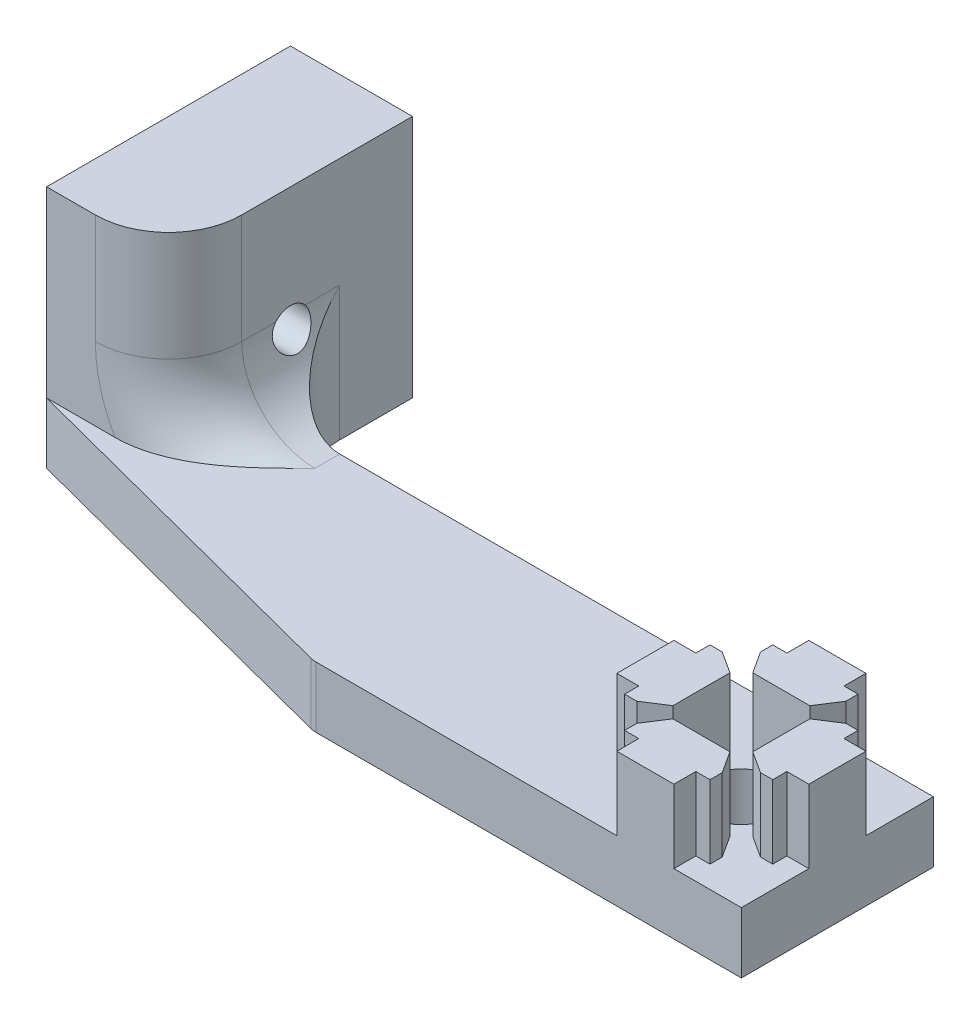
from build123d import *

# Parameters (mm, degrees)
BOSS_EXTRUDE1_DEPTH   = 7.62
BOSS_EXTRUDE1_2_DEPTH = 7.62
BOSS_EXTRUDE1_3_DEPTH = 7.62
BOSS_EXTRUDE1_4_DEPTH = 7.62
SKETCH2_W             = 82.1538108
SKETCH2_H             = 20
BOSS_EXTRUDE2_DEPTH   = 6.35
CUT_EXTRUDE1_DEPTH    = 75.17097352
FILLET1_R             = 2.54
SKETCH6_W             = 25.4
SKETCH6_H             = 25.4
BOSS_EXTRUDE7_DEPTH   = 12.7
FILLET3_R             = 7.62
FILLET5_R             = 7.62
SKETCH11_R            = 1.984375
CUT_EXTRUDE3_DEPTH    = 89.015038158
SKETCH12_R            = 3.556
CUT_EXTRUDE4_DEPTH    = 79.762749597


with BuildPart() as part:
    # Sketch1 → Boss-Extrude1 (new body)
    with BuildSketch(Plane(origin=(0, 0, 0), x_dir=(1, 0, 0), z_dir=(0, 1, 0))):
        Polygon((-2.9718, 10), (-2.9718, 7.714), (-4.4450054, 7.714), (-4.4450054, 6.444), (-2.9718, 4.158), (2.9718, 4.158), (4.4449946, 6.444), (4.4449946, 7.714), (2.9718, 7.714), (2.9718, 10), align=None)
    extrude(amount=BOSS_EXTRUDE1_DEPTH)



with BuildPart() as body_2:
    # Sketch1 → Boss-Extrude1 2 (new body)
    with BuildSketch(Plane(origin=(0, 0, 0), x_dir=(1, 0, 0), z_dir=(0, 1, 0))):
        Polygon((4.158, -2.9718), (4.158, 2.9718), (6.444, 4.4449946), (7.714, 4.4449946), (7.714, 2.9718), (10, 2.9718), (10, -2.9718), (7.714, -2.9718), (7.714, -4.4450054), (6.444, -4.4450054), align=None)
    extrude(amount=BOSS_EXTRUDE1_2_DEPTH)


with BuildPart() as body_3:
    # Sketch1 → Boss-Extrude1 3 (new body)
    with BuildSketch(Plane(origin=(0, 0, 0), x_dir=(1, 0, 0), z_dir=(0, 1, 0))):
        Polygon((4.4450054, -6.444), (2.9718, -4.158), (-2.9718, -4.158), (-4.4449946, -6.444), (-4.4449946, -7.714), (-2.9718, -7.714), (-2.9718, -10), (2.9718, -10), (2.9718, -7.714), (4.4450054, -7.714), align=None)
    extrude(amount=BOSS_EXTRUDE1_3_DEPTH)


with BuildPart() as body_4:
    # Sketch1 → Boss-Extrude1 4 (new body)
    with BuildSketch(Plane(origin=(0, 0, 0), x_dir=(1, 0, 0), z_dir=(0, 1, 0))):
        Polygon((-10, -2.9718), (-10, 2.9718), (-7.714, 2.9718), (-7.714, 4.4450054), (-6.444, 4.4450054), (-4.158, 2.9718), (-4.158, -2.9718), (-6.444, -4.4449946), (-7.714, -4.4449946), (-7.714, -2.9718), align=None)
    extrude(amount=BOSS_EXTRUDE1_4_DEPTH)


with BuildPart() as part_1:
    add(part.part)

    add(body_2.part)  # Boss-Extrude2 merges body 2

    add(body_3.part)  # Boss-Extrude2 merges body 3

    add(body_4.part)  # Boss-Extrude2 merges body 4
    # Sketch2 → Boss-Extrude2 (add)
    with BuildSketch(Plane.XZ):
        with Locations((-31.0769054, 0)):
            Rectangle(SKETCH2_W, SKETCH2_H)
    extrude(amount=BOSS_EXTRUDE2_DEPTH)

    # Sketch4 → Cut-Extrude1 (cut, through all)
    with BuildSketch(Plane(origin=(0, -6.35, 0), x_dir=(-1, 0, 0), z_dir=(0, -1, 0))):
        Polygon((72.1538108, -10), (34.6126108, -10), (72.1538108, -0.2108), align=None)
    extrude(amount=-CUT_EXTRUDE1_DEPTH, mode=Mode.SUBTRACT)

    # Fillet1
    fillet1_edges = [part_1.edges().sort_by_distance(p)[0] for p in [
        (-34.6126108, -3.175, 10),
    ]]
    fillet(fillet1_edges, radius=FILLET1_R)

    # Sketch6 → Boss-Extrude7 (add)
    with BuildSketch(Plane.ZY.offset(72.1538108)):
        with Locations((-12.4892, 6.35)):
            Rectangle(SKETCH6_W, SKETCH6_H)
    extrude(amount=-BOSS_EXTRUDE7_DEPTH)

    # Fillet3
    fillet3_edges = [part_1.edges().sort_by_distance(p)[0] for p in [
        (-59.4538108, 0, -4.8946),
        (-59.4538108, -3.175, -10),
    ]]
    fillet(fillet3_edges, radius=FILLET3_R)

    # Fillet5
    # the kernel refuses this fillet: 7.62 mm, written as the material it takes off along each edge
    with BuildSketch(Plane(origin=(-59.4538108, 38.1, 0.2108), x_dir=(-1, 0, 0), z_dir=(0, -1, 0))) as fillet5_piece_1:
        with BuildLine():
            CenterArc((FILLET5_R, FILLET5_R), FILLET5_R, 180, 90)
            Line((0, FILLET5_R), (0, 0))
            Line((0, 0), (FILLET5_R, 0))
        make_face()
    extrude(amount=30.48, mode=Mode.SUBTRACT)
    with BuildSketch(Plane(origin=(-51.8338108, 7.62, 0.2108), x_dir=(0.5976672776328273, 0.8017442392976484, 0), z_dir=(-0.8017442392976484, 0.5976672776328273, 0))) as fillet5_piece_2_section:
        with BuildLine():
            CenterArc((7.62 + FILLET5_R, FILLET5_R), FILLET5_R, 180, 90)
            Line((7.62, FILLET5_R), (7.62, 0))
            Line((7.62, 0), (7.62 + FILLET5_R, 0))
        make_face()
    fillet5_piece_2 = revolve(axis=Axis((-51.8338108, 7.62, 0.2108), (0, 0, -1)), revolution_arc=233.296989237, mode=Mode.PRIVATE)
    fillet5_piece_2 = split(fillet5_piece_2, bisect_by=Plane(origin=(-57.548345525, 0, -2.163807672), z_dir=(0, 1, 0)), keep=Keep.TOP, mode=Mode.PRIVATE)
    add(fillet5_piece_2, mode=Mode.SUBTRACT)

    # Sketch11 → Cut-Extrude3 (cut, through all)
    with BuildSketch(Plane.ZY.offset(72.1538108)):
        with Locations((-12.4892, 6.35)):
            Circle(SKETCH11_R)
    extrude(amount=-CUT_EXTRUDE3_DEPTH, mode=Mode.SUBTRACT)

    # Sketch12 → Cut-Extrude4 (cut, through all)
    with BuildSketch(Plane(origin=(0, 0, 0), x_dir=(1, 0, 0), z_dir=(0, 1, 0))):
        with Locations(Location((0, 0, 0), (0, 0, 270))):
            Circle(SKETCH12_R)
    extrude(amount=-CUT_EXTRUDE4_DEPTH, mode=Mode.SUBTRACT)


solid = part_1.part
